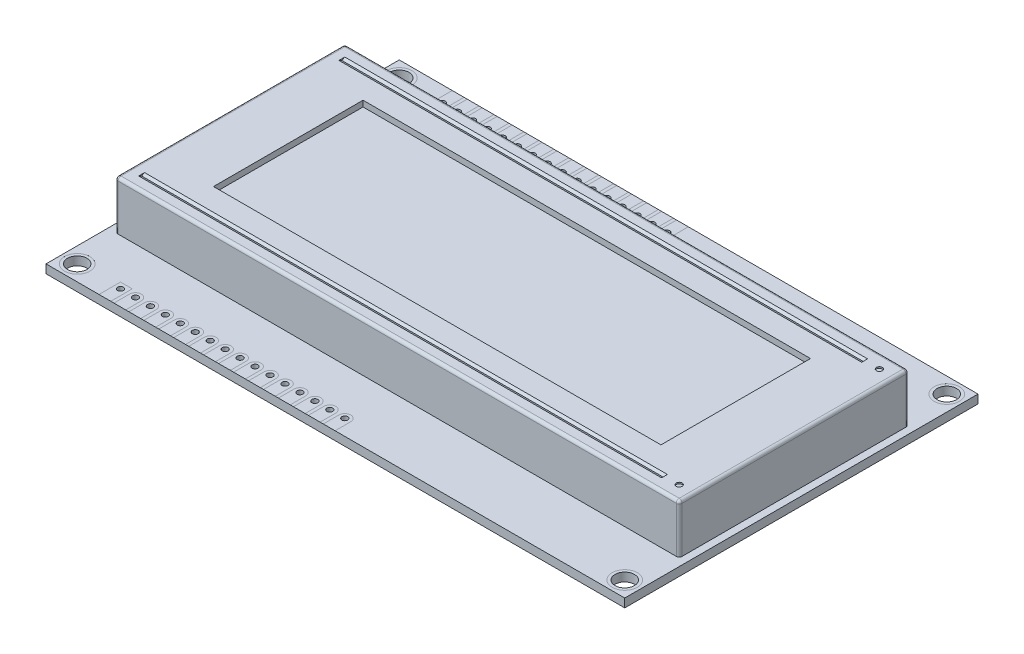
from build123d import *
from OCP.BRepFilletAPI import BRepFilletAPI_MakeChamfer

# Parameters (mm, degrees)
SKETCH1_W             = 98.3
SKETCH1_H             = 60
BOSS_EXTRUDE1_DEPTH   = 1.46
SKETCH1_3_R           = 2.15
CUT_EXTRUDE1_DEPTH    = 58.600816834
SKETCH1_4_R           = 2.15
SKETCH1_4_R_2         = 1.65
BOSS_EXTRUDE2_DEPTH   = 1.46
BOSS_EXTRUDE2_2_DEPTH = 1.46
BOSS_EXTRUDE2_3_DEPTH = 1.46
BOSS_EXTRUDE2_4_DEPTH = 1.46
SKETCH1_5_W           = 95.8
SKETCH1_5_H           = 39
BOSS_EXTRUDE3_DEPTH   = 8.3
SKETCH2_W             = 76
SKETCH2_H             = 25.4
CUT_EXTRUDE2_DEPTH    = 1
SKETCH3_R             = 0.5
SKETCH3_W             = 88.8
SKETCH3_H             = 1
CUT_EXTRUDE3_DEPTH    = 0.25
CHAMFER1_SIZE         = 0.25
CHAMFER1_SIZE_2       = 0.5
FILLET1_R             = 0.5
SKETCH4_7_R           = 0.5
CUT_EXTRUDE9_DEPTH    = 59.177422597


with BuildPart() as part:
    # Sketch1 → Boss-Extrude1 (new body)
    with BuildSketch(Plane(origin=(0, 0, 0), x_dir=(1, 0, 0), z_dir=(0, 1, 0))):
        Rectangle(SKETCH1_W, SKETCH1_H)
    extrude(amount=-BOSS_EXTRUDE1_DEPTH)

    # Sketch1<3> → Cut-Extrude1 (cut, through all)
    with BuildSketch(Plane(origin=(0, 0, 0), x_dir=(1, 0, 0), z_dir=(0, 1, 0))):
        with Locations(Location((-46.5, 27.35, 0), (0, 0, 270))):
            Circle(SKETCH1_3_R)
        with Locations(Location((46.5, 27.35, 0), (0, 0, 90))):
            Circle(SKETCH1_3_R)
        with Locations(Location((46.5, -27.35, 0), (0, 0, 270))):
            Circle(SKETCH1_3_R)
        with Locations(Location((-46.5, -27.35, 0), (0, 0, 90))):
            Circle(SKETCH1_3_R)
    extrude(amount=-CUT_EXTRUDE1_DEPTH, mode=Mode.SUBTRACT)

    # Sketch4<7> → Cut-Extrude9 (cut, through all)
    with BuildSketch(Plane(origin=(0, 0, 0), x_dir=(1, 0, 0), z_dir=(0, 1, 0))):
        with Locations(Location((-39.15, 27.35, 0), (0, 0, 270))):
            Circle(SKETCH4_7_R)
        with Locations(Location((-36.61, 27.35, 0), (0, 0, 270))):
            Circle(SKETCH4_7_R)
        with Locations(Location((-34.07, 27.35, 0), (0, 0, 270))):
            Circle(SKETCH4_7_R)
        with Locations(Location((-31.53, 27.35, 0), (0, 0, 270))):
            Circle(SKETCH4_7_R)
        with Locations(Location((-28.99, 27.35, 0), (0, 0, 270))):
            Circle(SKETCH4_7_R)
        with Locations(Location((-26.45, 27.35, 0), (0, 0, 270))):
            Circle(SKETCH4_7_R)
        with Locations(Location((-23.91, 27.35, 0), (0, 0, 270))):
            Circle(SKETCH4_7_R)
        with Locations(Location((-21.37, 27.35, 0), (0, 0, 270))):
            Circle(SKETCH4_7_R)
        with Locations(Location((-18.83, 27.35, 0), (0, 0, 270))):
            Circle(SKETCH4_7_R)
        with Locations(Location((-16.29, 27.35, 0), (0, 0, 270))):
            Circle(SKETCH4_7_R)
        with Locations(Location((-13.75, 27.35, 0), (0, 0, 270))):
            Circle(SKETCH4_7_R)
        with Locations(Location((-11.21, 27.35, 0), (0, 0, 270))):
            Circle(SKETCH4_7_R)
        with Locations(Location((-8.67, 27.35, 0), (0, 0, 270))):
            Circle(SKETCH4_7_R)
        with Locations(Location((-6.13, 27.35, 0), (0, 0, 270))):
            Circle(SKETCH4_7_R)
        with Locations(Location((-3.59, 27.35, 0), (0, 0, 270))):
            Circle(SKETCH4_7_R)
        with Locations(Location((-1.05, 27.35, 0), (0, 0, 270))):
            Circle(SKETCH4_7_R)
    cut_extrude9 = extrude(amount=-CUT_EXTRUDE9_DEPTH, mode=Mode.SUBTRACT)

    # Mirror1: Cut-Extrude9 across plane
    add(cut_extrude9.mirror(Plane.XY), mode=Mode.SUBTRACT)


with BuildPart() as body_2:
    # Sketch1<4> → Boss-Extrude2 (new body)
    with BuildSketch(Plane(origin=(0, 0, 0), x_dir=(1, 0, 0), z_dir=(0, 1, 0))):
        with Locations(Location((-46.5, 27.35, 0), (0, 0, 270))):
            Circle(SKETCH1_4_R)
        with Locations(Location((-46.5, 27.35, 0), (0, 0, 270))):
            Circle(SKETCH1_4_R_2, mode=Mode.SUBTRACT)
    extrude(amount=-BOSS_EXTRUDE2_DEPTH)


with BuildPart() as body_3:
    # Sketch1<4> → Boss-Extrude2 2 (new body)
    with BuildSketch(Plane(origin=(0, 0, 0), x_dir=(1, 0, 0), z_dir=(0, 1, 0))):
        with Locations(Location((46.5, 27.35, 0), (0, 0, 270))):
            Circle(SKETCH1_4_R)
        with Locations(Location((46.5, 27.35, 0), (0, 0, 270))):
            Circle(SKETCH1_4_R_2, mode=Mode.SUBTRACT)
    extrude(amount=-BOSS_EXTRUDE2_2_DEPTH)


with BuildPart() as body_4:
    # Sketch1<4> → Boss-Extrude2 3 (new body)
    with BuildSketch(Plane(origin=(0, 0, 0), x_dir=(1, 0, 0), z_dir=(0, 1, 0))):
        with Locations(Location((46.5, -27.35, 0), (0, 0, 270))):
            Circle(SKETCH1_4_R)
        with Locations(Location((46.5, -27.35, 0), (0, 0, 270))):
            Circle(SKETCH1_4_R_2, mode=Mode.SUBTRACT)
    extrude(amount=-BOSS_EXTRUDE2_3_DEPTH)


with BuildPart() as body_5:
    # Sketch1<4> → Boss-Extrude2 4 (new body)
    with BuildSketch(Plane(origin=(0, 0, 0), x_dir=(1, 0, 0), z_dir=(0, 1, 0))):
        with Locations(Location((-46.5, -27.35, 0), (0, 0, 270))):
            Circle(SKETCH1_4_R)
        with Locations(Location((-46.5, -27.35, 0), (0, 0, 270))):
            Circle(SKETCH1_4_R_2, mode=Mode.SUBTRACT)
    extrude(amount=-BOSS_EXTRUDE2_4_DEPTH)


with BuildPart() as body_6:
    # Sketch1<5> → Boss-Extrude3 (new body)
    with BuildSketch(Plane(origin=(0, 0, 0), x_dir=(1, 0, 0), z_dir=(0, 1, 0))):
        Rectangle(SKETCH1_5_W, SKETCH1_5_H)
    extrude(amount=BOSS_EXTRUDE3_DEPTH)

    # Sketch2 → Cut-Extrude2 (cut)
    with BuildSketch(Plane(origin=(0, 8.3, 0), x_dir=(-1, 0, 0), z_dir=(0, 1, 0))):
        Rectangle(SKETCH2_W, SKETCH2_H)
    extrude(amount=-CUT_EXTRUDE2_DEPTH, mode=Mode.SUBTRACT)

    # Sketch3 → Cut-Extrude3 (cut)
    with BuildSketch(Plane(origin=(0, 8.3, 0), x_dir=(1, 0, 0), z_dir=(0, 1, 0))):
        with Locations(Location((45.4, 17, 0), (0, 0, 270))):
            Circle(SKETCH3_R)
        with Locations(Location((45.4, -17, 0), (0, 0, 90))):
            Circle(SKETCH3_R)
        with Locations((-1.5, 17)):
            Rectangle(SKETCH3_W, SKETCH3_H)
        with Locations((-1.5, -17)):
            Rectangle(SKETCH3_W, SKETCH3_H)
    extrude(amount=-CUT_EXTRUDE3_DEPTH, mode=Mode.SUBTRACT)

    # Chamfer1
    chamfer1_edges_1 = [body_6.edges().sort_by_distance(p)[0] for p in [
        (-1.5, 8.05, 17.5),
    ]]
    chamfer1_side_1 = [body_6.faces().sort_by_distance(p)[0] for p in [
        (-1.5, 8.055, 17.5),
    ]]
    chamfer1_edges_2 = [body_6.edges().sort_by_distance(p)[0] for p in [
        (-1.5, 8.05, 16.5),
    ]]
    chamfer1_side_2 = [body_6.faces().sort_by_distance(p)[0] for p in [
        (-1.5, 8.055, 16.5),
    ]]
    chamfer1_edges_3 = [body_6.edges().sort_by_distance(p)[0] for p in [
        (-1.5, 8.05, -16.5),
    ]]
    chamfer1_side_3 = [body_6.faces().sort_by_distance(p)[0] for p in [
        (-1.5, 8.055, -16.5),
    ]]
    chamfer1_edges_4 = [body_6.edges().sort_by_distance(p)[0] for p in [
        (-1.5, 8.05, -17.5),
    ]]
    chamfer1_side_4 = [body_6.faces().sort_by_distance(p)[0] for p in [
        (-1.5, 8.055, -17.5),
    ]]
    chamfer1 = BRepFilletAPI_MakeChamfer(body_6.part.solid().wrapped)
    for e in chamfer1_edges_1:
        chamfer1.Add(CHAMFER1_SIZE - 0.0001, CHAMFER1_SIZE_2 - 0.0001, e.wrapped, chamfer1_side_1[0].wrapped)
    for e in chamfer1_edges_2:
        chamfer1.Add(CHAMFER1_SIZE - 0.0001, CHAMFER1_SIZE_2 - 0.0001, e.wrapped, chamfer1_side_2[0].wrapped)
    for e in chamfer1_edges_3:
        chamfer1.Add(CHAMFER1_SIZE - 0.0001, CHAMFER1_SIZE_2 - 0.0001, e.wrapped, chamfer1_side_3[0].wrapped)
    for e in chamfer1_edges_4:
        chamfer1.Add(CHAMFER1_SIZE - 0.0001, CHAMFER1_SIZE_2 - 0.0001, e.wrapped, chamfer1_side_4[0].wrapped)
    add(Compound.cast(chamfer1.Shape()), mode=Mode.REPLACE)  # a hair under: the kernel refuses the full size

    # Fillet1
    fillet1_edges = [body_6.edges().sort_by_distance(p)[0] for p in [
        (-47.9, 8.3, 0),
        (0, 8.3, 19.5),
        (47.9, 8.3, 0),
        (47.9, 4.15, 19.5),
        (-47.9, 4.15, 19.5),
        (-47.9, 4.15, -19.5),
        (47.9, 4.15, -19.5),
        (0, 8.3, -19.5),
    ]]
    fillet(fillet1_edges, radius=FILLET1_R)


solid = Compound([part.part, body_2.part, body_3.part, body_4.part, body_5.part, body_6.part])
